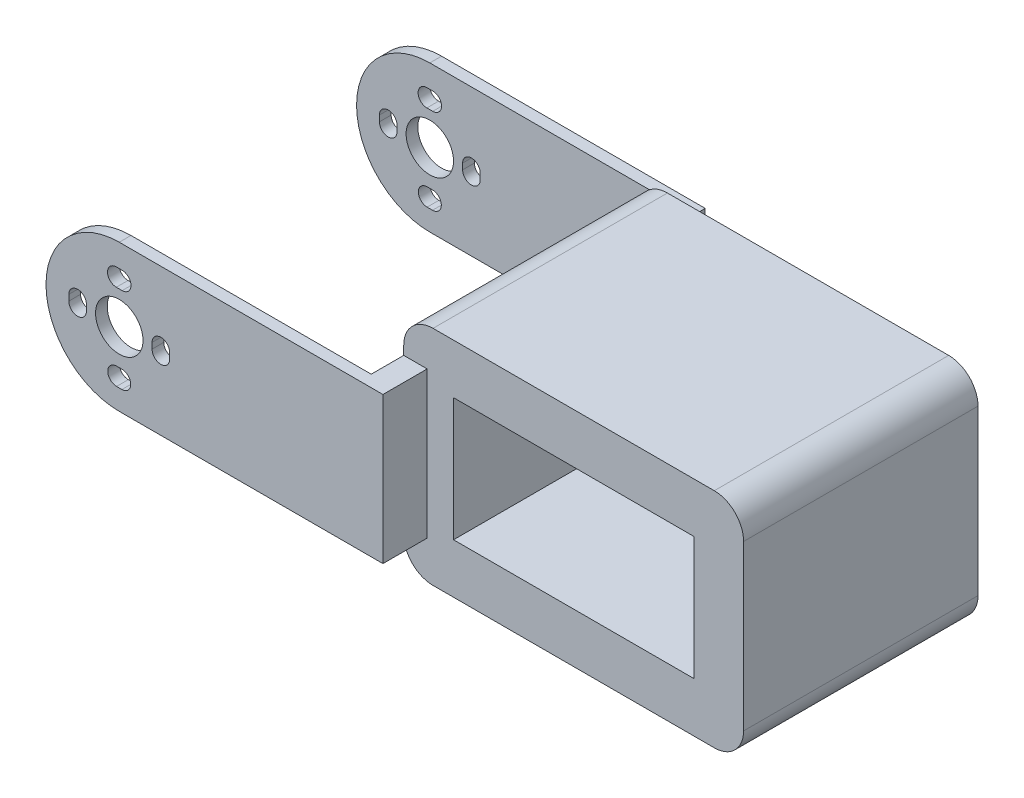
from build123d import *

# Parameters (mm, degrees)
SKETCH1_W           = 58
SKETCH1_H           = 38
SKETCH1_W_2         = 41
SKETCH1_H_2         = 21
BOSS_EXTRUDE1_DEPTH = 40
SKETCH2_W           = 4
SKETCH2_H           = 25
BOSS_EXTRUDE2_DEPTH = 5.55
SKETCH2_2_W         = 4
SKETCH2_2_H         = 25
BOSS_EXTRUDE3_DEPTH = 45.55
SKETCH3_R           = 4.05
BOSS_EXTRUDE6_DEPTH = 2
BOSS_EXTRUDE7_START = -53
SKETCH3_8_R         = 4.05
BOSS_EXTRUDE7_DEPTH = 53
CUT_EXTRUDE1_START  = -51
SKETCH3_11_R        = 4.05
CUT_EXTRUDE1_DEPTH  = 51
FILLET2_R           = 5
FILLET3_R           = 5
FILLET4_R           = 5
FILLET5_R           = 5


with BuildPart() as part:
    # Sketch1 → Boss-Extrude1 (new body)
    with BuildSketch(Plane.XY):
        with Locations((-0.095837804, -6.136072895)):
            Rectangle(SKETCH1_W, SKETCH1_H)
        with Locations((-0.095837804, -6.136072895)):
            Rectangle(SKETCH1_W_2, SKETCH1_H_2, mode=Mode.SUBTRACT)
    extrude(amount=BOSS_EXTRUDE1_DEPTH)

    # Sketch2 → Boss-Extrude2 (add)
    with BuildSketch(Plane.XY.offset(40)):
        with Locations((-27.095837804, -6.136072895)):
            Rectangle(SKETCH2_W, SKETCH2_H)
    extrude(amount=BOSS_EXTRUDE2_DEPTH)

    # Sketch2<2> → Boss-Extrude3 (add)
    with BuildSketch(Plane.XY.offset(40)):
        with Locations((-27.095837804, -6.136072895)):
            Rectangle(SKETCH2_2_W, SKETCH2_2_H)
    extrude(amount=-BOSS_EXTRUDE3_DEPTH)

    # Sketch3 → Boss-Extrude6 (add)
    with BuildSketch(Plane.XY.offset(45.55)):
        with BuildLine():
            Line((-25.095837804, -18.636072895), (-25.095837804, 6.363927105))
            Line((-25.095837804, 6.363927105), (-70.095837804, 6.363927105))
            ThreePointArc((-70.095837804, 6.363927105), (-82.595837804, -6.136072895), (-70.095837804, -18.636072895))
            Line((-70.095837804, -18.636072895), (-25.095837804, -18.636072895))
        make_face()
        with BuildLine():
            Line((-61.495837804, -5.636072895), (-61.495837804, -6.636072895))
            ThreePointArc((-61.495837804, -6.636072895), (-62.995837804, -8.136072895), (-64.495837804, -6.636072895))
            Line((-64.495837804, -6.636072895), (-64.495837804, -5.636072895))
            ThreePointArc((-64.495837804, -5.636072895), (-62.995837804, -4.136072895), (-61.495837804, -5.636072895))
        make_face(mode=Mode.SUBTRACT)
        with BuildLine():
            Line((-69.635749439, -15.176248856), (-70.555926168, -15.176248856))
            ThreePointArc((-70.555926168, -15.176248856), (-72.055926168, -13.676248856), (-70.555926168, -12.176248856))
            Line((-70.555926168, -12.176248856), (-69.635749439, -12.176248856))
            ThreePointArc((-69.635749439, -12.176248856), (-68.135749439, -13.676248856), (-69.635749439, -15.176248856))
        make_face(mode=Mode.SUBTRACT)
        with Locations((-70.095837804, -6.136072895)):
            Circle(SKETCH3_R, mode=Mode.SUBTRACT)
        with BuildLine():
            Line((-69.595837804, -0.536072895), (-70.595837804, -0.536072895))
            ThreePointArc((-70.595837804, -0.536072895), (-72.095837804, 0.963927105), (-70.595837804, 2.463927105))
            Line((-70.595837804, 2.463927105), (-69.595837804, 2.463927105))
            ThreePointArc((-69.595837804, 2.463927105), (-68.095837804, 0.963927105), (-69.595837804, -0.536072895))
        make_face(mode=Mode.SUBTRACT)
        with BuildLine():
            ThreePointArc((-78.695837804, -5.636072895), (-77.195837804, -4.136072895), (-75.695837804, -5.636072895))
            Line((-75.695837804, -5.636072895), (-75.695837804, -6.636072895))
            ThreePointArc((-75.695837804, -6.636072895), (-77.195837804, -8.136072895), (-78.695837804, -6.636072895))
            Line((-78.695837804, -6.636072895), (-78.695837804, -5.636072895))
        make_face(mode=Mode.SUBTRACT)
    extrude(amount=BOSS_EXTRUDE6_DEPTH)

    # Sketch3<8> → Boss-Extrude7 (add)
    with BuildSketch(Plane.XY.offset(45.55).offset(BOSS_EXTRUDE7_START)):
        with BuildLine():
            Line((-25.095837804, -18.636072895), (-25.095837804, 6.363927105))
            Line((-25.095837804, 6.363927105), (-70.095837804, 6.363927105))
            ThreePointArc((-70.095837804, 6.363927105), (-82.595837804, -6.136072895), (-70.095837804, -18.636072895))
            Line((-70.095837804, -18.636072895), (-25.095837804, -18.636072895))
        make_face()
        with BuildLine():
            Line((-61.495837804, -5.636072895), (-61.495837804, -6.636072895))
            ThreePointArc((-61.495837804, -6.636072895), (-62.995837804, -8.136072895), (-64.495837804, -6.636072895))
            Line((-64.495837804, -6.636072895), (-64.495837804, -5.636072895))
            ThreePointArc((-64.495837804, -5.636072895), (-62.995837804, -4.136072895), (-61.495837804, -5.636072895))
        make_face(mode=Mode.SUBTRACT)
        with BuildLine():
            Line((-69.635749439, -15.176248856), (-70.555926168, -15.176248856))
            ThreePointArc((-70.555926168, -15.176248856), (-72.055926168, -13.676248856), (-70.555926168, -12.176248856))
            Line((-70.555926168, -12.176248856), (-69.635749439, -12.176248856))
            ThreePointArc((-69.635749439, -12.176248856), (-68.135749439, -13.676248856), (-69.635749439, -15.176248856))
        make_face(mode=Mode.SUBTRACT)
        with Locations((-70.095837804, -6.136072895)):
            Circle(SKETCH3_8_R, mode=Mode.SUBTRACT)
        with BuildLine():
            Line((-69.595837804, -0.536072895), (-70.595837804, -0.536072895))
            ThreePointArc((-70.595837804, -0.536072895), (-72.095837804, 0.963927105), (-70.595837804, 2.463927105))
            Line((-70.595837804, 2.463927105), (-69.595837804, 2.463927105))
            ThreePointArc((-69.595837804, 2.463927105), (-68.095837804, 0.963927105), (-69.595837804, -0.536072895))
        make_face(mode=Mode.SUBTRACT)
        with BuildLine():
            ThreePointArc((-78.695837804, -5.636072895), (-77.195837804, -4.136072895), (-75.695837804, -5.636072895))
            Line((-75.695837804, -5.636072895), (-75.695837804, -6.636072895))
            ThreePointArc((-75.695837804, -6.636072895), (-77.195837804, -8.136072895), (-78.695837804, -6.636072895))
            Line((-78.695837804, -6.636072895), (-78.695837804, -5.636072895))
        make_face(mode=Mode.SUBTRACT)
    extrude(amount=BOSS_EXTRUDE7_DEPTH)

    # Sketch3<11> → Cut-Extrude1 (cut)
    with BuildSketch(Plane.XY.offset(45.55).offset(CUT_EXTRUDE1_START)):
        with BuildLine():
            Line((-29.095837804, -18.636072895), (-29.095837804, 6.363927105))
            Line((-29.095837804, 6.363927105), (-70.095837804, 6.363927105))
            ThreePointArc((-70.095837804, 6.363927105), (-82.595837804, -6.136072895), (-70.095837804, -18.636072895))
            Line((-70.095837804, -18.636072895), (-29.095837804, -18.636072895))
        make_face()
        with BuildLine():
            Line((-69.635749439, -15.176248856), (-70.555926168, -15.176248856))
            ThreePointArc((-70.555926168, -15.176248856), (-72.055926168, -13.676248856), (-70.555926168, -12.176248856))
            Line((-70.555926168, -12.176248856), (-69.635749439, -12.176248856))
            ThreePointArc((-69.635749439, -12.176248856), (-68.135749439, -13.676248856), (-69.635749439, -15.176248856))
        make_face(mode=Mode.SUBTRACT)
        with Locations((-70.095837804, -6.136072895)):
            Circle(SKETCH3_11_R, mode=Mode.SUBTRACT)
        with BuildLine():
            Line((-69.595837804, -0.536072895), (-70.595837804, -0.536072895))
            ThreePointArc((-70.595837804, -0.536072895), (-72.095837804, 0.963927105), (-70.595837804, 2.463927105))
            Line((-70.595837804, 2.463927105), (-69.595837804, 2.463927105))
            ThreePointArc((-69.595837804, 2.463927105), (-68.095837804, 0.963927105), (-69.595837804, -0.536072895))
        make_face(mode=Mode.SUBTRACT)
        with BuildLine():
            ThreePointArc((-64.495837804, -5.636072895), (-62.995837804, -4.136072895), (-61.495837804, -5.636072895))
            Line((-61.495837804, -5.636072895), (-61.495837804, -6.636072895))
            ThreePointArc((-61.495837804, -6.636072895), (-62.995837804, -8.136072895), (-64.495837804, -6.636072895))
            Line((-64.495837804, -6.636072895), (-64.495837804, -5.636072895))
        make_face(mode=Mode.SUBTRACT)
        with BuildLine():
            ThreePointArc((-78.695837804, -5.636072895), (-77.195837804, -4.136072895), (-75.695837804, -5.636072895))
            Line((-75.695837804, -5.636072895), (-75.695837804, -6.636072895))
            ThreePointArc((-75.695837804, -6.636072895), (-77.195837804, -8.136072895), (-78.695837804, -6.636072895))
            Line((-78.695837804, -6.636072895), (-78.695837804, -5.636072895))
        make_face(mode=Mode.SUBTRACT)
    extrude(amount=CUT_EXTRUDE1_DEPTH, mode=Mode.SUBTRACT)

    # Fillet2
    fillet2_edges = [part.edges().sort_by_distance(p)[0] for p in [
        (28.904162196, 12.863927105, 20),
    ]]
    fillet(fillet2_edges, radius=FILLET2_R)

    # Fillet3
    fillet3_edges = [part.edges().sort_by_distance(p)[0] for p in [
        (28.904162196, -25.136072895, 20),
    ]]
    fillet(fillet3_edges, radius=FILLET3_R)

    # Fillet4
    fillet4_edges = [part.edges().sort_by_distance(p)[0] for p in [
        (-29.095837804, 12.863927105, 20),
    ]]
    fillet(fillet4_edges, radius=FILLET4_R)

    # Fillet5
    fillet5_edges = [part.edges().sort_by_distance(p)[0] for p in [
        (-29.095837804, -25.136072895, 20),
    ]]
    fillet(fillet5_edges, radius=FILLET5_R)


solid = part.part
